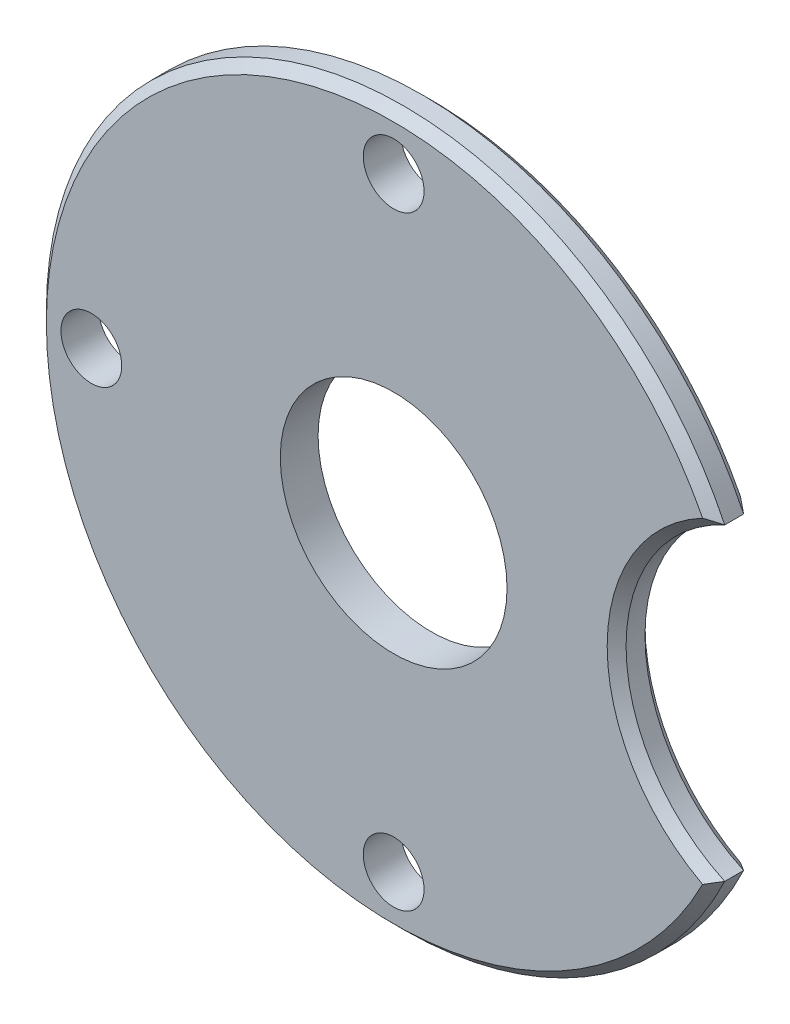
from build123d import *

# Parameters (mm, degrees)
SKETCH1_R           = 2.5527
SKETCH1_R_2         = 9.525
BOSS_EXTRUDE1_DEPTH = 3.175
CHAMFER1_SIZE       = 0.79375
CHAMFER2_SIZE       = 0.79375


with BuildPart() as part:
    # Sketch1 → Boss-Extrude1 (new body)
    with BuildSketch(Plane.XY):
        with BuildLine():
            ThreePointArc((27.02163125, -12.967352412), (18.7325, 0), (27.02163125, 12.967352412))
            ThreePointArc((27.02163125, 12.967352412), (-29.972, 0), (27.02163125, -12.967352412))
        make_face()
        with Locations((0, -25.4)):
            Circle(SKETCH1_R, mode=Mode.SUBTRACT)
        with Locations((-25.4, 0)):
            Circle(SKETCH1_R, mode=Mode.SUBTRACT)
        Circle(SKETCH1_R_2, mode=Mode.SUBTRACT)
        with Locations((0, 25.4)):
            Circle(SKETCH1_R, mode=Mode.SUBTRACT)
    extrude(amount=BOSS_EXTRUDE1_DEPTH)

    # Chamfer1
    chamfer1_edges = [part.edges().sort_by_distance(p)[0] for p in [
        (18.7325, 0, 3.175),
        (-29.972, 0, 3.175),
    ]]
    chamfer(chamfer1_edges, length=CHAMFER1_SIZE)

    # Chamfer2
    chamfer2_edges = [part.edges().sort_by_distance(p)[0] for p in [
        (18.7325, 0, 0),
        (-29.972, 0, 0),
    ]]
    chamfer(chamfer2_edges, length=CHAMFER2_SIZE)


solid = part.part
